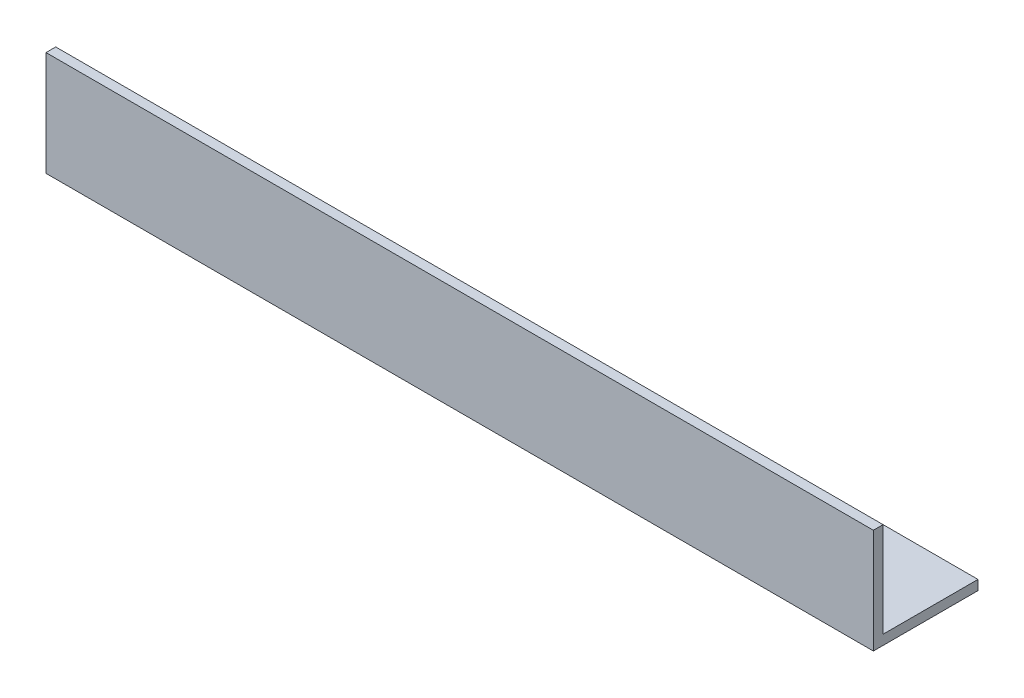
from build123d import *

# Parameters (mm, degrees)
EXTRUDE_1_DEPTH = 340


with BuildPart() as part:
    # Эскиз1 → Вытянуть-Тонкостенный1 (new body)
    with BuildSketch(Plane(origin=(0, 0, 0), x_dir=(0, 0, -1), z_dir=(1, 0, 0))):
        Polygon((0, 43), (0, 0), (43, 0), (43, 4), (4, 4), (4, 43), align=None)
    extrude(amount=EXTRUDE_1_DEPTH)


solid = part.part
